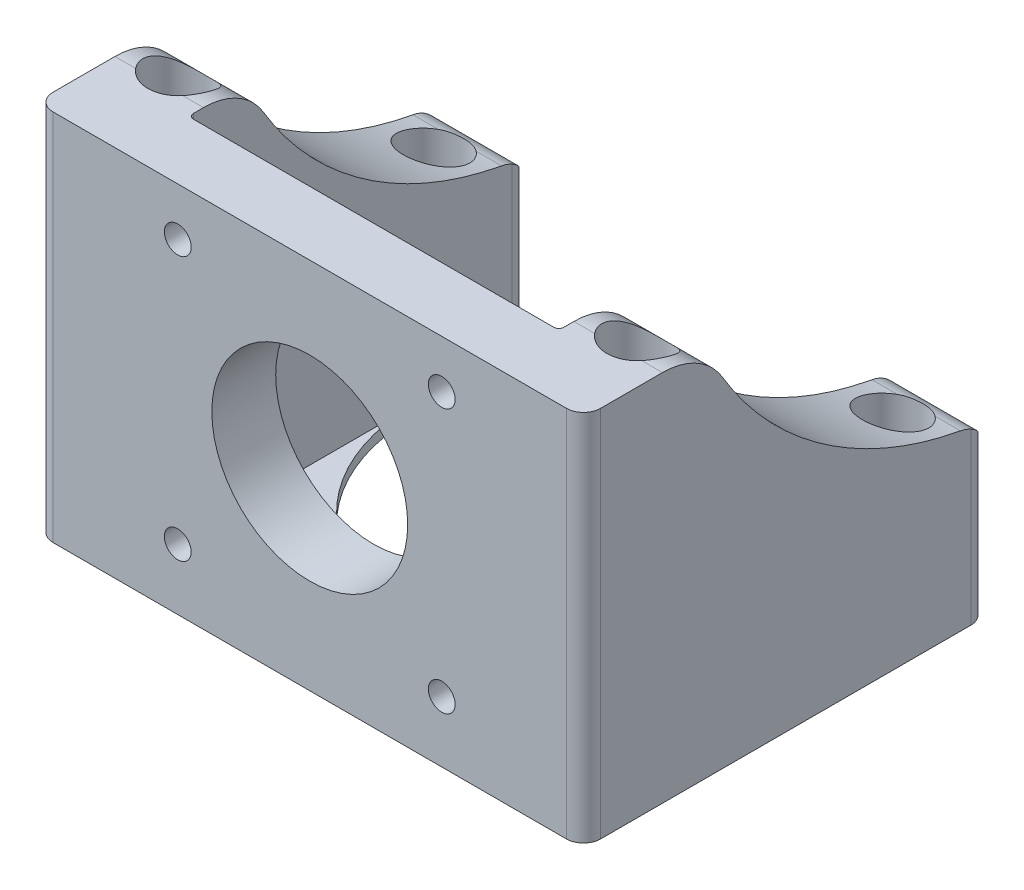
from build123d import *

# Parameters (mm, degrees)
MAIN_FACE_R                    = 1.5749999999999995
MAIN_FACE_R_2                  = 1.5750000000000013
MAIN_FACE_R_3                  = 11.5
MAINFACE_DEPTH                 = 7.5
SKETCH2_W                      = 7.500000000000001
SKETCH2_H                      = 42.30000000000015
SIDEPROFILE_DEPTH              = 11
NON_INTERFERING_FILLET_DEPTH   = 67.5049810164623
BASECLEARANCE_DEPTH            = 1.5
GROUDINGBOLTHOLES_DEPTH        = 68.46897435117894
GROUDINGBOLTHOLES_DEPTH_BACK   = 68.46897435117894
SKETCH5_R                      = 1.5749999999999995
BOLTACCESSHOLES_START          = -10
SKETCH5_3_R                    = 3.55
SKETCH5_3_R_2                  = 1.5749999999999995
SKETCH5_3_R_3                  = 3.5500000000000007
BOLTACCESSHOLES_DEPTH          = 47.50000000000001
HAPPYPRINTERCURVES_R           = 2
SKETCH6_W                      = 48.78690945060761
SKETCH6_H                      = 41.74981882727384
BASEPLATE_DEPTH                = 1.2
SUPPORTTORSIONBUTBREATHE_DEPTH = 67.6961957157231


with BuildPart() as part:
    # Main Face → MainFace (new body)
    with BuildSketch(Plane.XY):
        Polygon((0, 21.150000000000077), (21.150000000000077, 21.150000000000077), (21.150000000000087, 7.98e-14), (21.150000000000507, -21.149999999999572), (8.381e-14, -21.149999999999928), (-21.149999999999924, -21.149999999999928), (-21.149999999999995, -2.69e-15), (-21.149999999999856, 21.150000000000222), align=None)
        with Locations((15.499999999999996, 15.5)):
            Circle(MAIN_FACE_R, mode=Mode.SUBTRACT)
        with Locations((15.500000000000005, -15.500000000000002)):
            Circle(MAIN_FACE_R_2, mode=Mode.SUBTRACT)
        with Locations((-15.499999999999998, -15.500000000000012)):
            Circle(MAIN_FACE_R, mode=Mode.SUBTRACT)
        with Locations((-15.50000000000001, 15.49999999999999)):
            Circle(MAIN_FACE_R, mode=Mode.SUBTRACT)
        Circle(MAIN_FACE_R_3, mode=Mode.SUBTRACT)
    extrude(amount=MAINFACE_DEPTH)

    # Sketch2 → SideProfile (add)
    with BuildSketch(Plane.ZY.offset(21.149999999999995)):
        with Locations((3.7500000000000004, 2.1849e-13)):
            Rectangle(SKETCH2_W, SKETCH2_H)
        with BuildLine():
            Line((0, -21.14999999999986), (0, 21.150000000000293))
            Line((0, 21.150000000000293), (-1.771709500841494, 21.150000000000293))
            ThreePointArc((-1.7717095008414934, 21.150000000000297), (-5.828166751938932, 20.078151362319375), (-8.825687949345335, 17.14241097816094))
            ThreePointArc((-8.82568794934533, 17.142410978160935), (-20.697100679367818, 4.412586379453849), (-36.76838475660053, -2.2726737223876654))
            ThreePointArc((-36.76838475660055, -2.2726737223876654), (-39.086170348891756, -3.6262628829235943), (-40, -6.149999999999864))
            Line((-40, -6.149999999999864), (-40, -21.149999999999864))
            Line((-40, -21.149999999999864), (0, -21.149999999999856))
        make_face()
    sideprofile = extrude(amount=SIDEPROFILE_DEPTH)

    # Sketch3 → Non-interfering fillet (cut, symmetric)
    with BuildSketch(Plane(origin=(0, 21.150000000000077, 0), x_dir=(1, 0, 0), z_dir=(0, 1, 0))):
        with BuildLine():
            Line((-21.75000000000007, 0.5999999999999999), (-21.750000000000068, 41.938133152744264))
            Line((-21.750000000000068, 41.938133152744264), (-16.932175207311897, 41.938133152744264))
            Line((-16.932175207311897, 41.938133152744264), (-16.932175207311897, 2.9783080433489855))
            Line((-16.932175207311897, 2.9783080433489855), (-21.149999999999856, 0))
            ThreePointArc((-21.149999999999856, 0), (-21.574264068711923, 0.17573593128799603), (-21.75000000000007, 0.5999999999999999))
        make_face()
    non_interfering_fillet = extrude(amount=NON_INTERFERING_FILLET_DEPTH, both=True, mode=Mode.SUBTRACT)

    # Mirror1: SideProfile, Non-interfering fillet across plane
    add(sideprofile.mirror(Plane(origin=(0, 0, 0), x_dir=(0, 0, 1), z_dir=(1, 0, 0))))
    add(non_interfering_fillet.mirror(Plane(origin=(0, 0, 0), x_dir=(0, 0, 1), z_dir=(1, 0, 0))), mode=Mode.SUBTRACT)

    # Sketch4 → BaseClearance (add)
    with BuildSketch(Plane.XZ.offset(21.149999999999928)):
        with BuildLine():
            Line((21.749999999999716, -0.5999999999999999), (21.749999999999712, -39.99999999999999))
            Line((21.749999999999712, -39.99999999999999), (32.149999999999565, -40))
            Line((32.149999999999565, -40), (32.149999999999565, 7.5))
            Line((32.149999999999565, 7.5), (-32.150000000000276, 7.5))
            Line((-32.150000000000276, 7.5), (-32.150000000000276, -40))
            Line((-32.150000000000276, -40), (-21.750000000000433, -40))
            Line((-21.750000000000433, -40), (-21.75000000000043, -0.5999999999999998))
            ThreePointArc((-21.75000000000043, -0.5999999999999998), (-21.574264068712278, -0.17573593128799736), (-21.150000000000215, 0))
            Line((-21.150000000000215, 0), (21.149999999999498, 1.73e-15))
            ThreePointArc((21.149999999999498, 1.73e-15), (21.574264068711567, -0.17573593128799248), (21.749999999999716, -0.5999999999999999))
        make_face()
    extrude(amount=BASECLEARANCE_DEPTH)

    # Sketch5 → GroudingBoltHoles (cut, two sides: drawn at the far end of the back side and taken through both)
    with BuildSketch(Plane.XZ.offset(22.64999999999993).offset(-GROUDINGBOLTHOLES_DEPTH_BACK)):
        with Locations((-26.95000000000035, -4.0000000000000036)):
            Circle(SKETCH5_R)
        with Locations((-26.950000000000344, -34)):
            Circle(SKETCH5_R)
        with Locations((26.95000000000035, -33.99999999999999)):
            Circle(SKETCH5_R)
        with Locations((26.95000000000035, -3.9999999999999964)):
            Circle(SKETCH5_R)
    extrude(amount=GROUDINGBOLTHOLES_DEPTH + GROUDINGBOLTHOLES_DEPTH_BACK, mode=Mode.SUBTRACT)

    # Sketch5<3> → BoltAccessHoles (cut)
    # profile 1 of 4: a face of its own
    with BuildSketch(Plane.XZ.offset(22.64999999999993).offset(BOLTACCESSHOLES_START)):
        with Locations((-26.950000000000344, -34)):
            Circle(SKETCH5_3_R)
        with Locations((-26.950000000000344, -34)):
            Circle(SKETCH5_3_R_2, mode=Mode.SUBTRACT)
    # profile 2 of 4: a face of its own
    with BuildSketch(Plane.XZ.offset(22.64999999999993).offset(BOLTACCESSHOLES_START)):
        with Locations((-26.95000000000035, -4.0000000000000036)):
            Circle(SKETCH5_3_R_3)
    # profile 3 of 4: a face of its own
    with BuildSketch(Plane.XZ.offset(22.64999999999993).offset(BOLTACCESSHOLES_START)):
        with Locations(Location((26.95000000000035, -3.9999999999999964, 0), (0, 0, 38.879713196))):
            Circle(SKETCH5_3_R_3)
    # profile 4 of 4: a face of its own
    with BuildSketch(Plane.XZ.offset(22.64999999999993).offset(BOLTACCESSHOLES_START)):
        with Locations(Location((26.95000000000035, -33.99999999999999, 0), (0, 0, 308.755289776))):
            Circle(SKETCH5_3_R)
    extrude(amount=-BOLTACCESSHOLES_DEPTH, mode=Mode.SUBTRACT)

    # HappyPrinterCurves
    # the kernel refuses this fillet: 2 mm, written as the material it takes off along each edge
    with BuildSketch(Plane(origin=(32.1499999999999, -27.649999999999395, -40), x_dir=(0, 0, 1), z_dir=(1.29e-15, 1, 0))) as happyprintercurves_piece_1:
        with BuildLine():
            CenterArc((HAPPYPRINTERCURVES_R, -HAPPYPRINTERCURVES_R), HAPPYPRINTERCURVES_R, 90, 90)
            Line((0, -HAPPYPRINTERCURVES_R), (0, 0))
            Line((0, 0), (HAPPYPRINTERCURVES_R, 0))
        make_face()
    extrude(amount=26.49999999999942, mode=Mode.SUBTRACT)
    with BuildSketch(Plane(origin=(21.750000000000068, -1.1499999999999382, -40), x_dir=(0, 4.3e-16, 1), z_dir=(1.72e-15, -1, 4.3e-16))) as happyprintercurves_piece_2:
        with BuildLine():
            CenterArc((HAPPYPRINTERCURVES_R, -HAPPYPRINTERCURVES_R), HAPPYPRINTERCURVES_R, 90, 90)
            Line((0, -HAPPYPRINTERCURVES_R), (0, 0))
            Line((0, 0), (HAPPYPRINTERCURVES_R, 0))
        make_face()
    extrude(amount=26.49999999999963, mode=Mode.SUBTRACT)
    with BuildSketch(Plane(origin=(-32.149999999999984, -1.1499999999999737, -40), x_dir=(0, 0, 1), z_dir=(4.74e-15, -1, 0))) as happyprintercurves_piece_3:
        with BuildLine():
            CenterArc((HAPPYPRINTERCURVES_R, -HAPPYPRINTERCURVES_R), HAPPYPRINTERCURVES_R, 90, 90)
            Line((0, -HAPPYPRINTERCURVES_R), (0, 0))
            Line((0, 0), (HAPPYPRINTERCURVES_R, 0))
        make_face()
    extrude(amount=26.500000000000487, mode=Mode.SUBTRACT)
    with BuildSketch(Plane(origin=(-32.1499999999999, -27.65000000000046, 7.5), x_dir=(1, 3.89e-15, 0), z_dir=(-3.89e-15, 1, 0))) as happyprintercurves_piece_4:
        with BuildLine():
            CenterArc((HAPPYPRINTERCURVES_R, HAPPYPRINTERCURVES_R), HAPPYPRINTERCURVES_R, 180, 90)
            Line((0, HAPPYPRINTERCURVES_R), (0, 0))
            Line((0, 0), (HAPPYPRINTERCURVES_R, 0))
        make_face()
    extrude(amount=53.800000000000644, mode=Mode.SUBTRACT)
    with BuildSketch(Plane(origin=(-21.750000000000068, -27.65000000000029, -40), x_dir=(0, 0, 1), z_dir=(-1.08e-15, 1, 0))) as happyprintercurves_piece_5:
        with BuildLine():
            CenterArc((HAPPYPRINTERCURVES_R, -HAPPYPRINTERCURVES_R), HAPPYPRINTERCURVES_R, 90, 90)
            Line((0, -HAPPYPRINTERCURVES_R), (0, 0))
            Line((0, 0), (HAPPYPRINTERCURVES_R, 0))
        make_face()
    extrude(amount=26.500000000000348, mode=Mode.SUBTRACT)
    with BuildSketch(Plane(origin=(32.150000000000084, 26.150000000000183, 7.5), x_dir=(0, 0, -1), z_dir=(-2.6e-15, -1, 0))) as happyprintercurves_piece_6:
        with BuildLine():
            CenterArc((HAPPYPRINTERCURVES_R, -HAPPYPRINTERCURVES_R), HAPPYPRINTERCURVES_R, 90, 90)
            Line((0, -HAPPYPRINTERCURVES_R), (0, 0))
            Line((0, 0), (HAPPYPRINTERCURVES_R, 0))
        make_face()
    extrude(amount=53.79999999999958, mode=Mode.SUBTRACT)

    # Sketch6 → BasePlate (add)
    with BuildSketch(Plane.XZ.offset(22.64999999999993)):
        with Locations((-0.09860427356243306, -19.12509058636308)):
            Rectangle(SKETCH6_W, SKETCH6_H)
    extrude(amount=-BASEPLATE_DEPTH)

    # Sketch7 → SupportTorsionButBreathe (cut, through all)
    with BuildSketch(Plane(origin=(3.5542e-13, -21.449999999999932, 0), x_dir=(1, 1.657e-14, 0), z_dir=(-1.657e-14, 1, 0))):
        with BuildLine():
            Line((21.75000000000003, 36.768384756600554), (21.74999999999979, 26.401553875860724))
            ThreePointArc((21.74999999999979, 26.401553875860724), (-4e-15, 4.651553875860934), (-21.74999999999979, 26.401553875860724))
            Line((-21.74999999999979, 26.401553875860724), (-21.750000000000107, 36.76838475660055))
            Line((-21.750000000000107, 36.76838475660055), (-21.750000000000114, 38))
            ThreePointArc((-21.750000000000114, 38), (-22.335786437627018, 39.41421356237322), (-23.750000000000167, 40))
            Line((-23.750000000000167, 40), (-23.750000000000167, 46.1872525671472))
            Line((-23.750000000000167, 46.1872525671472), (23.749999999999964, 46.1872525671472))
            Line((23.749999999999964, 46.1872525671472), (23.749999999999964, 40))
            ThreePointArc((23.749999999999964, 40), (22.33578643762671, 39.414213562373185), (21.75000000000002, 38))
            Line((21.75000000000002, 38), (21.75000000000003, 36.768384756600554))
        make_face()
    extrude(amount=-SUPPORTTORSIONBUTBREATHE_DEPTH, mode=Mode.SUBTRACT)


solid = part.part
